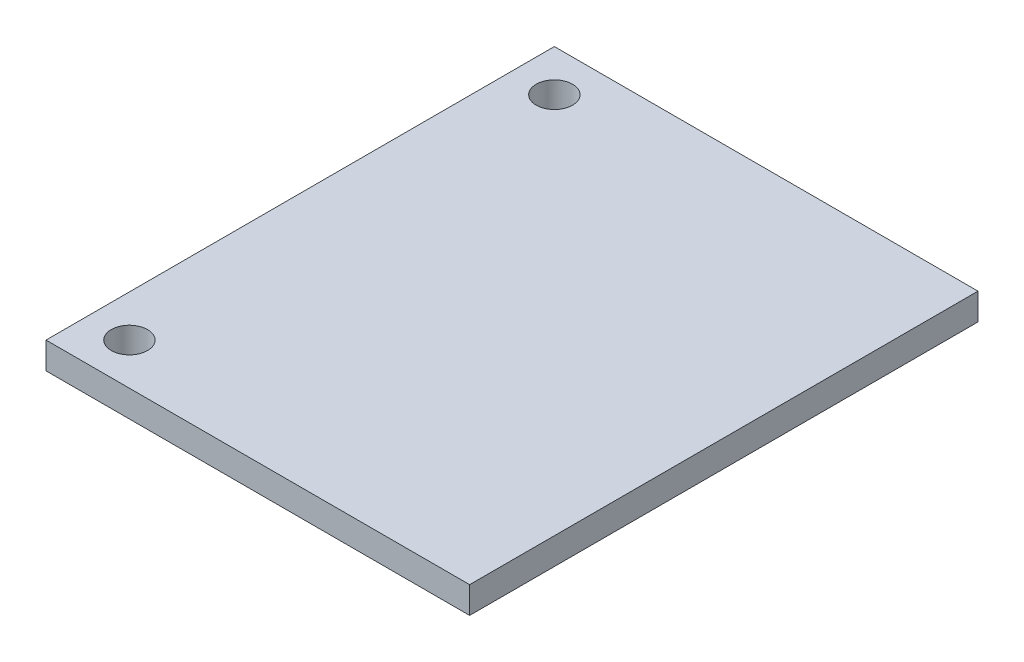
from build123d import *

# Parameters (mm, degrees)
SKETCH1_W           = 25.4
SKETCH1_H           = 30.48
BOSS_EXTRUDE1_DEPTH = 1.6
SKETCH2_R           = 1.09
CUT_EXTRUDE1_DEPTH  = 1.6


with BuildPart() as part:
    # Sketch1 → Boss-Extrude1 (new body)
    with BuildSketch(Plane(origin=(0, 0, 0), x_dir=(1, 0, 0), z_dir=(0, 1, 0))):
        Rectangle(SKETCH1_W, SKETCH1_H)
    extrude(amount=BOSS_EXTRUDE1_DEPTH)

    # Sketch2 → Cut-Extrude1 (cut)
    with BuildSketch(Plane(origin=(0, 1.6, 0), x_dir=(1, 0, 0), z_dir=(0, 1, 0))):
        with Locations((-10.2, 12.74)):
            Circle(SKETCH2_R)
    cut_extrude1 = extrude(amount=-CUT_EXTRUDE1_DEPTH, mode=Mode.SUBTRACT)

    # Mirror1: Cut-Extrude1 across plane
    add(cut_extrude1.mirror(Plane.XY), mode=Mode.SUBTRACT)


solid = part.part
